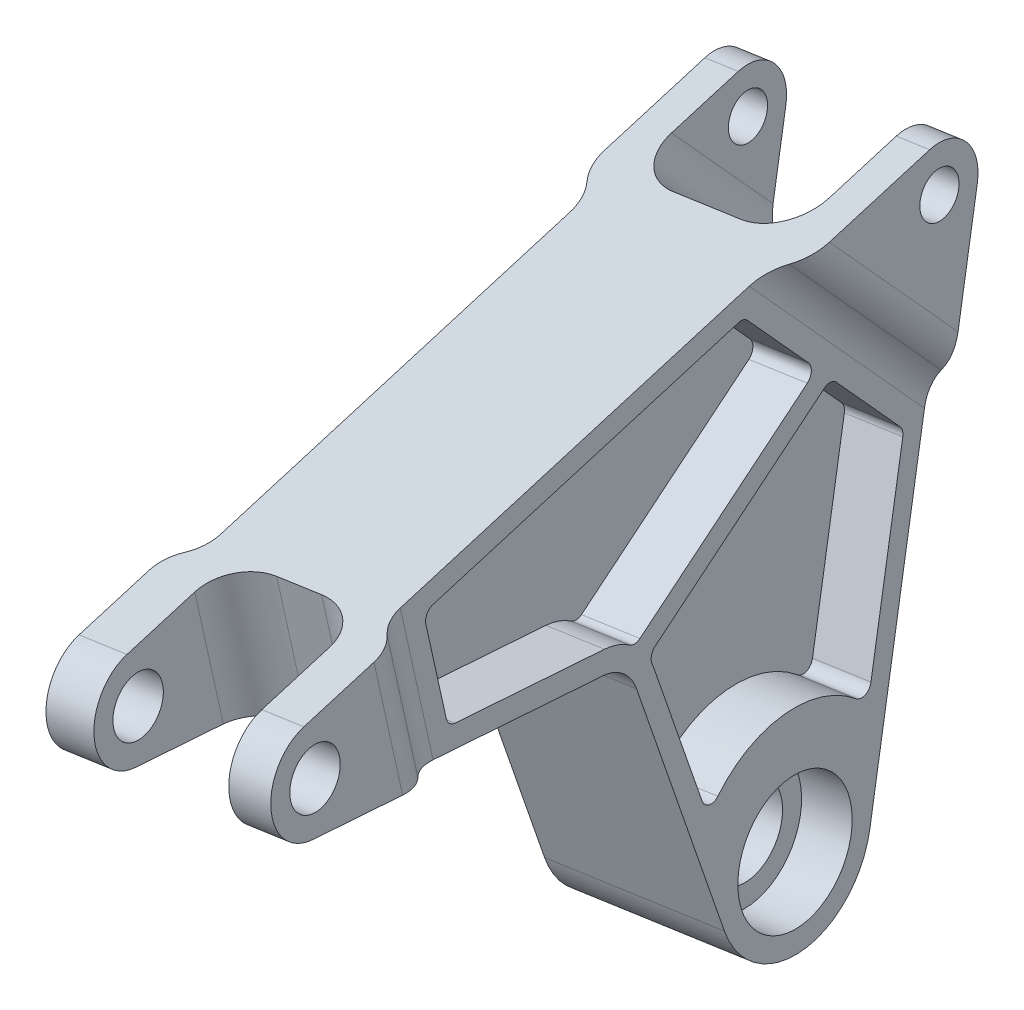
from build123d import *

# Parameters (mm, degrees)
SKETCH1_R                      = 3.263900000000121
SKETCH1_R_2                    = 4.199999999999976
BOSS_EXTRUDE1_DEPTH            = 15.875
FILLET7_R                      = 6.35
CUT_EXTRUDE6_DEPTH             = 25.4
FILLET8_R                      = 6.35
CUT_EXTRUDE8_REACH             = 1218.683
CUT_EXTRUDE8_END_RADIUS        = 6.438900000000022
CUT_EXTRUDE8_DIRECTION_2_DEPTH = 16.054722017999996
FILLET9_R                      = 6.35
CUT_EXTRUDE9_DEPTH             = 3.175
FILLET14_R                     = 6.35
FILLET15_R                     = 6.35
FILLET16_R                     = 6.35
FILLET17_R                     = 6.35
SKETCH29_R                     = 9.525000000000018
CUT_EXTRUDE10_DEPTH            = 7.14375
SKETCH30_R                     = 6.349999999999941
CUT_EXTRUDE11_DEPTH            = 906.2428652120986
FILLET18_R                     = 6.35
FILLET19_R                     = 6.35
FILLET20_R                     = 6.35
FILLET21_R                     = 6.35
CUT_EXTRUDE12_DEPTH            = 8.255
FILLET22_R                     = 1.5875


with BuildPart() as part:
    # Sketch1 → Boss-Extrude1 (new, symmetric)
    with BuildSketch(Plane(origin=(-803.6566332789141, -58.26345281012812, 68.82567852426239), x_dir=(-0.08515417095162939, -0.00241614660156225, -0.9963648575723355), z_dir=(0.9937636896807375, 0.07204582335356381, -0.08510657089457987))):
        with BuildLine():
            ThreePointArc((-664.2038450226969, 436.8184776127322), (-651.8745198787159, 427.9178662715624), (-639.8468613838354, 437.2220896073974))
            Line((-639.8468613838348, 437.2220896073972), (-619.5515204929051, 510.40226291213133))
            ThreePointArc((-619.5515204929051, 510.40226291213133), (-620.9838530756886, 516.4455246988489), (-626.8562553144544, 518.4672768094307))
            Line((-626.8562553144544, 518.4672768094307), (-733.0342996841451, 500.0570320892499))
            ThreePointArc((-733.0342996841451, 500.05703208924996), (-739.1483230926673, 492.6676503574812), (-732.7916358037484, 485.48595339028384))
            Line((-732.7916358037484, 485.4859533902838), (-677.0205822251494, 477.71877799538424))
            Line((-677.0205822251494, 477.71877799538424), (-664.2038450226976, 436.81847761273195))
        make_face()
        with Locations(Location((-625.7562257117465, 512.1230378414245, 0), (0, 0, 0.138795824))):
            Circle(SKETCH1_R, mode=Mode.SUBTRACT)
        with Locations(Location((-731.7743456050367, 492.79045512904787, 0), (0, 0, 0.138795824))):
            Circle(SKETCH1_R_2, mode=Mode.SUBTRACT)
    extrude(amount=BOSS_EXTRUDE1_DEPTH, both=True)

    # Fillet7
    fillet7_edges = [part.edges().sort_by_distance(p)[0] for p in [
        (-780.3962698306742, 419.8482713749311, 745.1689599242694),
    ]]
    fillet(fillet7_edges, radius=FILLET7_R)

    # Sketch23 → Cut-Extrude6 (cut)
    with BuildSketch(Plane(origin=(61.972947811989165, -108.23638463445343, 632.0133130126799), x_dir=(0.9953619214294605, 0.016238085990304504, -0.09482072522199067), z_dir=(0.09620106739496219, -0.1680161441472004, 0.9810789621319872))):
        Polygon((-851.4974580179244, 570.6197226277428), (-849.4828619685262, 535.112578894877), (-830.4634507696352, 536.1916978167321), (-832.4780468190336, 571.698841549598), align=None)
    extrude(amount=-CUT_EXTRUDE6_DEPTH, mode=Mode.SUBTRACT)

    # Fillet8
    fillet8_edges = [part.edges().sort_by_distance(p)[0] for p in [
        (-768.4981336258412, 435.73746338308155, 780.7155057686616),
        (-787.4293319142591, 434.3649904481961, 782.3367859442033),
    ]]
    fillet(fillet8_edges, radius=FILLET8_R)

    # Cut-Extrude8: up to this cylinder (the profile starts inside it)
    cut_extrude8_end = Plane(origin=(-787.2383908251443, 454.03916279522144, 694.2194195095605), z_dir=(-0.9937636896807374, -0.0720458233535638, 0.08510657089457985)) * Cylinder(CUT_EXTRUDE8_END_RADIUS, 2451.2438, mode=Mode.PRIVATE)
    # Sketch26 → Cut-Extrude8 (cut, up to the surface)
    with BuildSketch(Plane(origin=(12.989728013299839, -77.83595490095189, 85.78614441110385), x_dir=(-0.993770984048656, -0.07487836809153875, 0.0825376353848), z_dir=(-0.11144160447231, 0.6677710026657366, -0.7359773480151642)), mode=Mode.PRIVATE) as cut_extrude8_sk1:
        Polygon((794.3756771448955, 828.136387084358), (794.5699361916237, 777.3363870843579), (816.8963729530036, 777.4217633111716), (816.7021139062754, 828.2217633111715), align=None)
    cut_extrude8_tool1 = extrude(cut_extrude8_sk1.sketch, amount=CUT_EXTRUDE8_REACH, mode=Mode.PRIVATE) & cut_extrude8_end
    add(cut_extrude8_tool1.solids().sort_by_distance((-787.621991, 456.37034, 691.713663))[0], mode=Mode.SUBTRACT)

    # Sketch26 → Cut-Extrude8 direction 2 (cut)
    with BuildSketch(Plane(origin=(12.989728013299839, -77.83595490095189, 85.78614441110385), x_dir=(-0.993770984048656, -0.07487836809153875, 0.0825376353848), z_dir=(-0.11144160447231, 0.6677710026657366, -0.7359773480151642))):
        Polygon((794.3756771448955, 828.136387084358), (794.5699361916237, 777.3363870843579), (816.8963729530036, 777.4217633111716), (816.7021139062754, 828.2217633111715), align=None)
    extrude(amount=-CUT_EXTRUDE8_DIRECTION_2_DEPTH, mode=Mode.SUBTRACT)

    # Fillet9
    fillet9_edges = [part.edges().sort_by_distance(p)[0] for p in [
        (-796.9266720049268, 444.8135668092432, 704.4509735768399),
        (-774.7393076109009, 446.4221050889288, 702.550833211105),
    ]]
    fillet(fillet9_edges, radius=FILLET9_R)

    # Sketch28 → Cut-Extrude9 (cut)
    with BuildSketch(Plane(origin=(-819.4326318525958, -59.407180255866336, 70.17674533721404), x_dir=(0.08496772843683141, 0.004995311208659764, 0.9963711818344676), z_dir=(-0.9937636896807374, -0.07204582335356427, 0.0851065708945801))):
        with BuildLine():
            Line((627.1625420198034, 485.8765159269481), (651.6049859690769, 512.7230828073026))
            Line((651.6049859690769, 512.7230828073026), (717.0206192545211, 501.2063227964691))
            Line((717.0206192545211, 501.2063227964691), (713.4230156056034, 480.7717977405854))
            Line((713.4230156056034, 480.7717977405854), (682.2365581379875, 476.51067285676993))
            ThreePointArc((682.2365581379875, 476.51067285676993), (679.0046113636374, 475.0752012300429), (677.0416730946137, 472.1336145671395))
            Line((677.0416730946137, 472.1336145671395), (665.3311932697678, 435.0994522969059))
            ThreePointArc((665.3311932697678, 435.0994522969059), (652.9788932558142, 426.23075311845423), (640.9753347674774, 435.5660476702974))
            Line((640.9753347674774, 435.5660476702974), (627.1625420198034, 485.8765159269481))
        make_face()
    cut_extrude9 = extrude(amount=-CUT_EXTRUDE9_DEPTH, mode=Mode.SUBTRACT)

    # Mirror4: Cut-Extrude9 across plane
    add(cut_extrude9.mirror(Plane(origin=(-803.6566332789141, -58.26345281012812, 68.82567852426239), x_dir=(0.08488379068765235, 0.00615390022091489, 0.9963718540738523), z_dir=(0.9937636896807375, 0.07204582335356381, -0.08510657089457987))), mode=Mode.SUBTRACT)

    # Fillet14
    # the kernel refuses this fillet: 6.35 mm, written as the material it takes off along each edge
    with BuildSketch(Plane(origin=(-763.9240545414428, 459.87606491191445, 784.86418850568), x_dir=(-0.9937636896807339, -0.07204582335356931, 0.08510657089461458), z_dir=(0.05638336371836082, -0.9831479922388159, -0.17389922844161387))) as fillet14_piece_1:
        with BuildLine():
            CenterArc((6.350000000000176, -5.499261314031187), FILLET14_R, 120.00000000000045, 60.00000000000114)
            Line((1.7393e-13, -5.499261314031369), (-0.12699999999987513, -5.499261314031325))
            Line((-0.12699999999987513, -5.499261314031325), (-0.12700000000006137, 7.226e-14))
            Line((-0.12700000000006137, 7.226e-14), (3.717e-14, 0.12700000000007206))
            ThreePointArc((3.717e-14, 0.12700000000007206), (1.5875000000000965, 0.12700000000011827), (3.1115000000000648, 0.10998522628065008))
            Line((3.1115000000000648, 0.10998522628065008), (3.17500000000012, -2e-17))
        make_face()
    extrude(amount=48.245103312962, mode=Mode.SUBTRACT)

    # Fillet15
    fillet15_edges = [part.edges().sort_by_distance(p)[0] for p in [
        (-765.7191436523169, 435.93128119402047, 780.9395087471651),
    ]]
    fillet(fillet15_edges, radius=FILLET15_R)

    # Fillet16
    # the kernel refuses this fillet: 6.35 mm, written as the material it takes off along each edge
    with BuildSketch(Plane(origin=(-795.4760516888064, 457.58861002043943, 787.566322131583), x_dir=(0.09620106739496583, -0.1680161441471998, 0.9810789621319869), z_dir=(0.056383363718361654, -0.9831479922388158, -0.17389922844161396))) as fillet16_piece_1:
        with BuildLine():
            CenterArc((5.499261314031349, -6.350000000000004), FILLET16_R, 89.99999999999983, 59.99999999999977)
            Line((2.1372e-13, -3.174999999999983), (-0.10998522628039077, -3.1114999999999853))
            ThreePointArc((-0.10998522628039077, -3.1114999999999853), (-0.1270000000000597, -1.587499999999776), (-0.1270000000000243, 6.167e-14))
            Line((-0.1270000000000243, 6.167e-14), (7.628e-14, 0.12700000000006137))
            Line((7.628e-14, 0.12700000000006137), (5.4992613140314255, 0.12700000000005307))
            Line((5.4992613140314255, 0.12700000000005307), (5.499261314031368, -8e-17))
        make_face()
    extrude(amount=48.24510331296339, mode=Mode.SUBTRACT)

    # Fillet17
    fillet17_edges = [part.edges().sort_by_distance(p)[0] for p in [
        (-790.9607413702078, 434.1013172808399, 783.1012156478874),
    ]]
    fillet(fillet17_edges, radius=FILLET17_R)

    # Sketch29 → Cut-Extrude10 (cut)
    with BuildSketch(Plane(origin=(-816.2774321378596, -59.17843476671879, 69.90653197462376), x_dir=(0.08496772843683141, 0.004995311208659761, 0.9963711818344676), z_dir=(-0.9937636896807374, -0.07204582335356424, 0.0851065708945801))):
        with Locations(Location((653.2221478363805, 438.92842326730624, 0), (0, 0, 359.713042845))):
            Circle(SKETCH29_R)
    cut_extrude10 = extrude(amount=-CUT_EXTRUDE10_DEPTH, mode=Mode.SUBTRACT)

    # Mirror6: Cut-Extrude10 across plane
    add(cut_extrude10.mirror(Plane(origin=(-803.6566332789141, -58.26345281012812, 68.82567852426239), x_dir=(0.08488379068765235, 0.00615390022091489, 0.9963718540738523), z_dir=(0.9937636896807375, 0.07204582335356381, -0.08510657089457987))), mode=Mode.SUBTRACT)

    # Sketch30 → Cut-Extrude11 (cut, through all)
    with BuildSketch(Plane(origin=(-809.1782327797032, -58.663757416136754, 69.29855190879563), x_dir=(0.08496772843683141, 0.004995311208659758, 0.9963711818344676), z_dir=(-0.9937636896807374, -0.07204582335356423, 0.0851065708945801))):
        with Locations(Location((653.2221478363805, 438.9284232673062, 0), (0, 0, 359.713042845))):
            Circle(SKETCH30_R)
    extrude(amount=-CUT_EXTRUDE11_DEPTH, mode=Mode.SUBTRACT)

    # Fillet18
    # the kernel refuses this fillet: 6.35 mm, written as the material it takes off along each edge
    with BuildSketch(Plane(origin=(-801.2813108853807, 418.14787225507484, 686.3920398850967), x_dir=(0.9937636896807204, 0.07204582335366592, -0.08510657089469212), z_dir=(0.00380760617239137, 0.7408719776966206, 0.6716354776209593))) as fillet18_piece_1:
        with BuildLine():
            CenterArc((6.35000000000041, 5.499261314030801), FILLET18_R, 179.99999999999162, 60.0000000000021)
            Line((4.066e-13, 5.499261314031734), (-0.12699999999964662, 5.499261314031687))
            Line((-0.12699999999964662, 5.499261314031687), (-0.12700000000005465, -5.457e-14))
            Line((-0.12700000000005465, -5.457e-14), (-5.076e-14, -0.1269999999999836))
            ThreePointArc((-5.076e-14, -0.1269999999999836), (1.5875000000000143, -0.12700000000015826), (3.111499999999835, -0.10998522628064958))
            Line((3.111499999999835, -0.10998522628064958), (3.1749999999998253, 4e-17))
        make_face()
    extrude(amount=63.8029343325191, mode=Mode.SUBTRACT)

    # Fillet19
    fillet19_edges = [part.edges().sort_by_distance(p)[0] for p in [
        (-798.0046429473542, 442.01152081511304, 707.5479836595266),
    ]]
    fillet(fillet19_edges, radius=FILLET19_R)

    # Fillet20
    # the kernel refuses this fillet: 6.35 mm, written as the material it takes off along each edge
    with BuildSketch(Plane(origin=(-769.7293137380176, 420.4353271465504, 683.6899062591938), x_dir=(-0.11144160447232392, 0.6677710026657372, -0.7359773480151613), z_dir=(0.0038076061723917327, 0.7408719776966206, 0.6716354776209593))) as fillet20_piece_1:
        with BuildLine():
            CenterArc((5.499261314031944, 6.350000000000002), FILLET20_R, 209.99999999999807, 60.000000000001535)
            Line((6.1001e-13, 3.1750000000001637), (-0.10998522627997129, 3.1115000000001984))
            ThreePointArc((-0.10998522627997129, 3.1115000000001984), (-0.1269999999998684, 1.587499999999964), (-0.12699999999996808, 3.003e-14))
            Line((-0.12699999999996808, 3.003e-14), (7.233e-14, -0.12700000000005462))
            Line((7.233e-14, -0.12700000000005462), (5.499261314031964, -0.1270000000000532))
            Line((5.499261314031964, -0.1270000000000532), (5.499261314031899, 2e-17))
        make_face()
    extrude(amount=63.80293433251974, mode=Mode.SUBTRACT)

    # Fillet21
    fillet21_edges = [part.edges().sort_by_distance(p)[0] for p in [
        (-772.7630452294634, 443.8414847282936, 705.3862767588042),
    ]]
    fillet(fillet21_edges, radius=FILLET21_R)

    # Sketch31 → Cut-Extrude12 (cut)
    with BuildSketch(Plane(origin=(-816.2774321378596, -59.17843476671879, 69.90653197462376), x_dir=(0.08496772843683141, 0.00499531120865976, 0.9963711818344676), z_dir=(-0.9937636896807374, -0.07204582335356424, 0.0851065708945801))):
        with BuildLine():
            Line((674.89672333572, 475.06621853047307), (642.8078588238949, 494.0354384472156))
            Line((642.807858823895, 494.0354384472155), (631.5959908804484, 481.7207876200674))
            Line((631.5959908804484, 481.7207876200674), (640.0621753209273, 450.88432237161936))
            ThreePointArc((640.0621753209274, 450.8843223716194), (653.5627042491733, 456.70516147569845), (666.8303845646924, 450.3715125855905))
            Line((666.8303845646924, 450.3715125855905), (674.0144117362669, 473.09085730973936))
            ThreePointArc((674.0144117362669, 473.09085730973936), (674.3993015391981, 474.10366959785017), (674.89672333572, 475.06621853047307))
        make_face()
        with BuildLine():
            Line((656.1572086631237, 508.697810753842), (644.945340719677, 496.3831599266939))
            Line((644.945340719677, 496.3831599266939), (676.9276979560174, 477.47690141298455))
            ThreePointArc((676.9276979560175, 477.47690141298443), (679.2112410996338, 478.9158383382181), (681.806739301328, 479.65644474418536))
            Line((681.806739301328, 479.6564447441853), (707.6795808792585, 483.1915499794374))
            Line((707.6795808792585, 483.1915499794374), (710.4861416611554, 499.1329215743282))
            Line((710.4861416611554, 499.1329215743282), (656.1572086631237, 508.697810753842))
        make_face()
    cut_extrude12 = extrude(amount=-CUT_EXTRUDE12_DEPTH, mode=Mode.SUBTRACT)

    # Mirror7: Cut-Extrude12 across plane
    add(cut_extrude12.mirror(Plane(origin=(-803.6566332789141, -58.26345281012812, 68.82567852426239), x_dir=(0.08488379068765235, 0.00615390022091489, 0.9963718540738523), z_dir=(0.9937636896807375, 0.07204582335356381, -0.08510657089457987))), mode=Mode.SUBTRACT)

    # Fillet22
    fillet22_edges = [part.edges().sort_by_distance(p)[0] for p in [
        (-789.1370396345999, 420.73051927759144, 744.5791420768076),
        (-793.2197196550782, 439.4276482053311, 712.7347253120122),
        (-793.1563076799398, 451.76614995770234, 723.920160538413),
        (-787.8494256367547, 442.4976264112924, 778.0408732089827),
        (-786.9367740043706, 426.58386105891134, 775.226046206104),
        (-788.0377184094101, 393.64546844047766, 734.487097923037),
        (-790.3491820896078, 394.0232236490786, 707.8166191749503),
        (-793.2952207798138, 424.7368779237731, 699.4168474441651),
        (-793.2318088046756, 437.07537967614434, 710.6022826705657),
        (-789.1355326904995, 418.3159857862957, 742.5527473430857),
        (-772.0989611750235, 421.96574491898843, 743.11998991882),
        (-769.8986955447944, 427.8190867003083, 773.7668940481163),
        (-770.8113471771785, 443.7328520526894, 776.581721050995),
        (-776.1182292203634, 453.0013755990992, 722.4610083804254),
        (-776.1816411955019, 440.66287384672796, 711.2755731540245),
        (-773.3111036300314, 395.2584492904755, 706.3574670169627),
        (-770.9996399498339, 394.8806940818746, 733.0279457650495),
        (-772.0974542309233, 419.5512114276926, 741.093595185098),
        (-776.1937303450991, 438.3106053175412, 709.1431305125781),
        (-776.2571423202376, 425.9721035651701, 697.9576952861775),
    ]]
    fillet(fillet22_edges, radius=FILLET22_R)


solid = part.part
